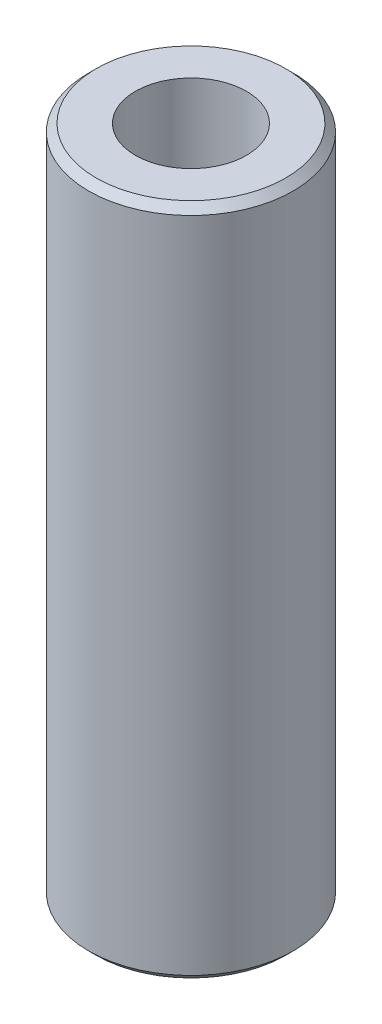
from build123d import *

# Parameters (mm, degrees)
SKETCH1_R           = 60
BOSS_EXTRUDE1_DEPTH = 394.880098972
SKETCH2_R           = 32.580804139
CUT_EXTRUDE1_DEPTH  = 404.893912512
CHAMFER1_SIZE       = 4.412012985


with BuildPart() as part:
    # Sketch1 → Boss-Extrude1 (new body)
    with BuildSketch(Plane(origin=(0, 0, 0), x_dir=(1, 0, 0), z_dir=(0, 1, 0))):
        Circle(SKETCH1_R)
    extrude(amount=BOSS_EXTRUDE1_DEPTH)

    # Sketch2 → Cut-Extrude1 (cut, through all)
    with BuildSketch(Plane(origin=(0, 0, 0), x_dir=(1, 0, 0), z_dir=(0, 1, 0))):
        Circle(SKETCH2_R)
    extrude(amount=CUT_EXTRUDE1_DEPTH, mode=Mode.SUBTRACT)

    # Chamfer1
    chamfer1_edges = [part.edges().sort_by_distance(p)[0] for p in [
        (-60, 394.880098972, 0),
        (-60, 0, 0),
    ]]
    chamfer(chamfer1_edges, length=CHAMFER1_SIZE)


solid = part.part
